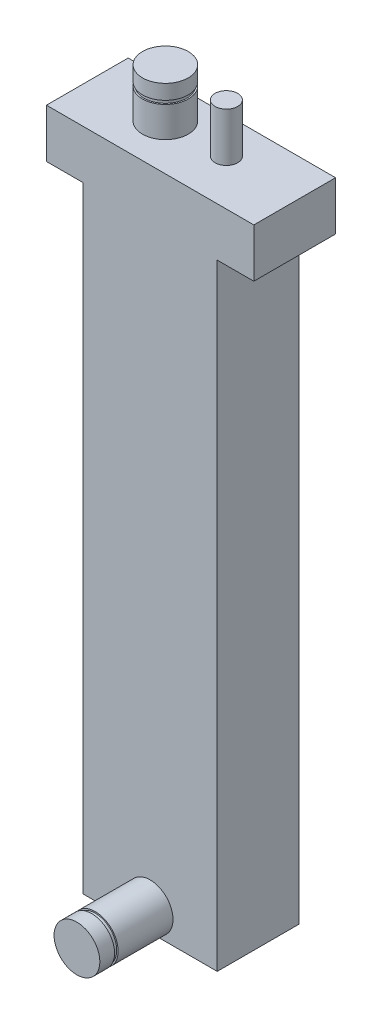
from build123d import *

# Parameters (mm, degrees)
SKETCH1_W              = 33.02
SKETCH1_H              = 19.05
BOSS_EXTRUDE1_DEPTH    = 10.16
SKETCH2_R              = 4.7625
SKETCH2_R_2            = 2.357295936
BOSS_EXTRUDE2_DEPTH    = 10.16
SKETCH5_W              = 19.05
SKETCH5_H              = 10.16
BOSS_EXTRUDE3_DEPTH    = 5.08
SKETCH6_W              = 19.05
SKETCH6_H              = 10.16
BOSS_EXTRUDE4_DEPTH    = 5.08
SKETCH7_W              = 27.94
SKETCH7_H              = 19.05
BOSS_EXTRUDE5_DEPTH    = 128.27
SKETCH9_R              = 4.7625
BOSS_EXTRUDE6_DEPTH    = 15.24
SKETCH10_W             = 43.18
SKETCH10_H             = 138.43
CUT_EXTRUDE1_DEPTH     = 2.032
CUT_EXTRUDE2_START     = 20.955
CUT_EXTRUDE2_OUTLINE_R = 4.7625
CUT_EXTRUDE2_DEPTH     = 0.7366
SKETCH11_R             = 4.4704
BOSS_EXTRUDE7_DEPTH    = 0.7366
CUT_EXTRUDE3_START     = 16.51
CUT_EXTRUDE3_OUTLINE_R = 4.7625
CUT_EXTRUDE3_DEPTH     = 0.7366
SKETCH12_R             = 4.4704
BOSS_EXTRUDE8_DEPTH    = 0.7366


# Read off the part's stored shape, not the designer's step: Cut-Extrude2, Cut-Extrude3
with BuildPart() as part:
    # Sketch1 → Boss-Extrude1 (new body)
    with BuildSketch(Plane(origin=(0, 0, 0), x_dir=(1, 0, 0), z_dir=(0, 1, 0))):
        with Locations((-5.08, 0)):
            Rectangle(SKETCH1_W, SKETCH1_H)
    extrude(amount=BOSS_EXTRUDE1_DEPTH)

    # Sketch2 → Boss-Extrude2 (add)
    with BuildSketch(Plane(origin=(0, 10.16, 0), x_dir=(1, 0, 0), z_dir=(0, 1, 0))):
        with Locations(Location((-11.43, 0, 0), (0, 0, 270))):
            Circle(SKETCH2_R)
        with Locations(Location((1.27, 0, 0), (0, 0, 270))):
            Circle(SKETCH2_R_2)
    extrude(amount=BOSS_EXTRUDE2_DEPTH)

    # Sketch5 → Boss-Extrude3 (add)
    with BuildSketch(Plane.ZY.offset(21.59)):
        with Locations((0, 5.08)):
            Rectangle(SKETCH5_W, SKETCH5_H)
    extrude(amount=BOSS_EXTRUDE3_DEPTH)

    # Sketch6 → Boss-Extrude4 (add)
    with BuildSketch(Plane(origin=(11.43, 0, 0), x_dir=(0, 0, -1), z_dir=(1, 0, 0))):
        with Locations((0, 5.08)):
            Rectangle(SKETCH6_W, SKETCH6_H)
    extrude(amount=BOSS_EXTRUDE4_DEPTH)

    # Sketch7 → Boss-Extrude5 (add)
    with BuildSketch(Plane(origin=(0, 0, 0), x_dir=(-1, 0, 0), z_dir=(0, -1, 0))):
        with Locations((5.08, 0)):
            Rectangle(SKETCH7_W, SKETCH7_H)
    extrude(amount=BOSS_EXTRUDE5_DEPTH)

    # Sketch9 → Boss-Extrude6 (add)
    with BuildSketch(Plane.XY.offset(9.525)):
        with Locations(Location((-5.08, -123.5075, 0), (0, 0, 270))):
            Circle(SKETCH9_R)
    extrude(amount=BOSS_EXTRUDE6_DEPTH)

    # Sketch10 → Cut-Extrude1 (cut)
    with BuildSketch(Plane(origin=(0, 0, -9.525), x_dir=(-1, 0, 0), z_dir=(0, 0, -1))):
        with Locations((5.08, -59.055)):
            Rectangle(SKETCH10_W, SKETCH10_H)
    extrude(amount=-CUT_EXTRUDE1_DEPTH, mode=Mode.SUBTRACT)

    # Cut-Extrude2 outline → Cut-Extrude2 (cut)
    with BuildSketch(Plane.XY.offset(CUT_EXTRUDE2_START)):
        with Locations((-5.08, -123.5075)):
            Circle(CUT_EXTRUDE2_OUTLINE_R)
    extrude(amount=CUT_EXTRUDE2_DEPTH, mode=Mode.SUBTRACT)

    # Sketch11 → Boss-Extrude7 (add)
    with BuildSketch(Plane.XY.offset(20.955)):
        with Locations((-5.08, -123.5075)):
            Circle(SKETCH11_R)
    extrude(amount=BOSS_EXTRUDE7_DEPTH)

    # Cut-Extrude3 outline → Cut-Extrude3 (cut)
    with BuildSketch(Plane(origin=(0, 0, 0), x_dir=(1, 0, 0), z_dir=(0, 1, 0)).offset(CUT_EXTRUDE3_START)):
        with Locations((-11.43, 0)):
            Circle(CUT_EXTRUDE3_OUTLINE_R)
    extrude(amount=CUT_EXTRUDE3_DEPTH, mode=Mode.SUBTRACT)

    # Sketch12 → Boss-Extrude8 (add)
    with BuildSketch(Plane(origin=(0, 16.51, 0), x_dir=(1, 0, 0), z_dir=(0, 1, 0))):
        with Locations(Location((-11.43, 0, 0), (0, 0, 270))):
            Circle(SKETCH12_R)
    extrude(amount=BOSS_EXTRUDE8_DEPTH)


solid = part.part
